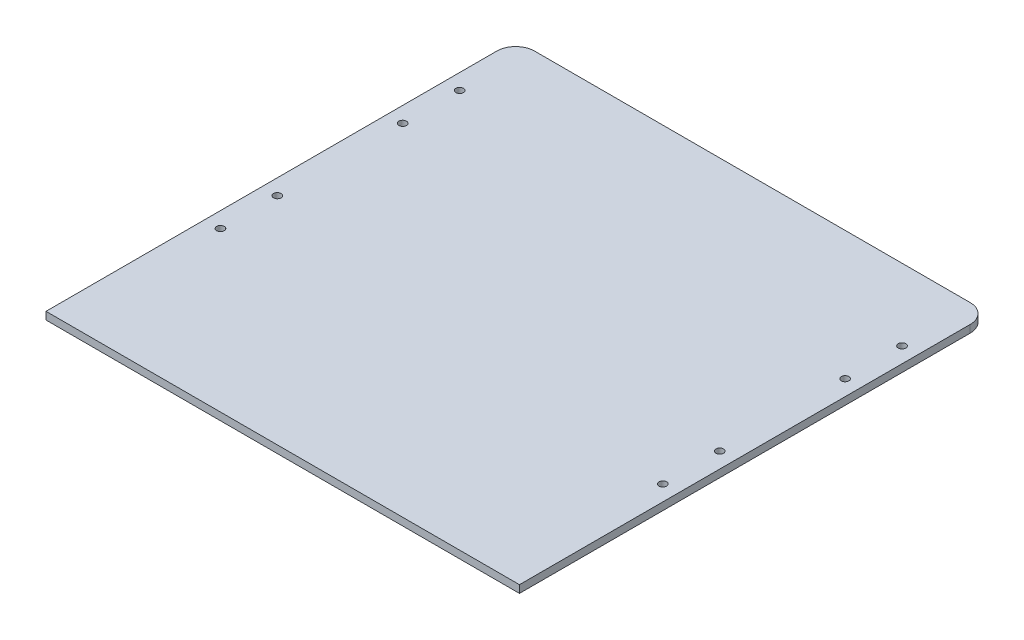
from build123d import *

# Parameters (mm, degrees)
SALIENTE_EXTRUIR1_DEPTH = 2
CROQUIS2_R              = 2
CORTAR_EXTRUIR1_DEPTH   = 10


with BuildPart() as part:
    # Croquis1 → Saliente-Extruir1 (new, symmetric)
    with BuildSketch(Plane(origin=(0, 0, 0), x_dir=(1, 0, 0), z_dir=(0, 1, 0))):
        with BuildLine():
            Line((-125, -124), (125, -124))
            Line((125, -124), (125, 114))
            ThreePointArc((125, 114), (122.071067812, 121.071067812), (115, 124))
            Line((115, 124), (-115, 124))
            ThreePointArc((-115, 124), (-122.071067812, 121.071067812), (-125, 114))
            Line((-125, 114), (-125, -124))
        make_face()
    extrude(amount=SALIENTE_EXTRUIR1_DEPTH, both=True)

    # Croquis2 → Cortar-Extruir1 (cut)
    with BuildSketch(Plane(origin=(0, 2, 0), x_dir=(1, 0, 0), z_dir=(0, 1, 0))):
        with Locations((-116.8, 86.2)):
            Circle(CROQUIS2_R)
        with Locations((-116.8, 56.15)):
            Circle(CROQUIS2_R)
        with Locations((-116.8, -10.05)):
            Circle(CROQUIS2_R)
        with Locations((-116.8, -40.1)):
            Circle(CROQUIS2_R)
        with Locations((116.8, -40.1)):
            Circle(CROQUIS2_R)
        with Locations((116.8, -10.05)):
            Circle(CROQUIS2_R)
        with Locations((116.8, 56.15)):
            Circle(CROQUIS2_R)
        with Locations((116.8, 86.2)):
            Circle(CROQUIS2_R)
    extrude(amount=-CORTAR_EXTRUIR1_DEPTH, mode=Mode.SUBTRACT)


solid = part.part
